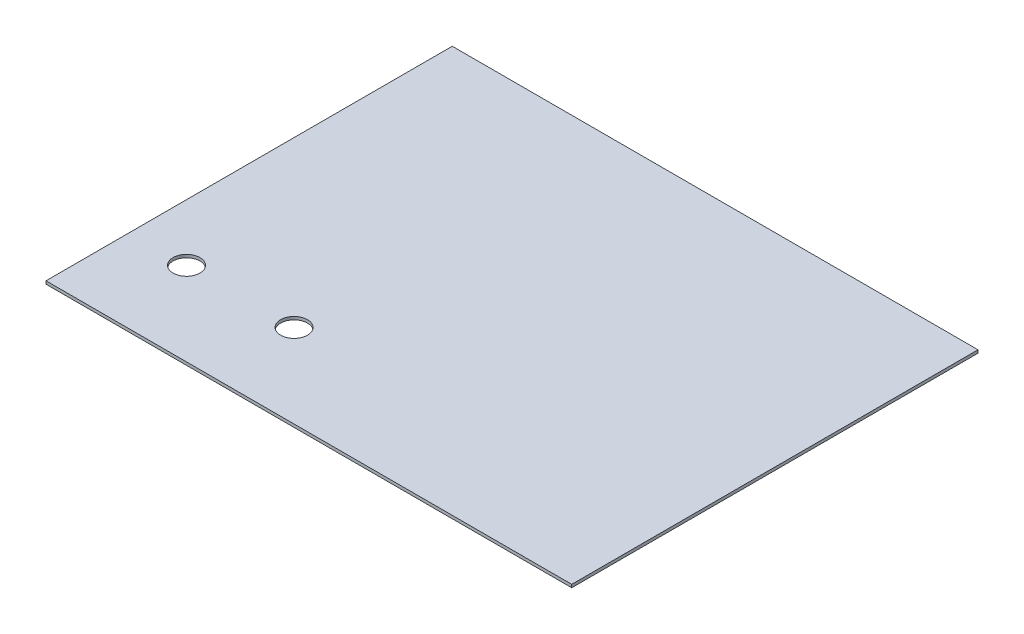
from build123d import *

# Parameters (mm, degrees)
SKETCH1_W           = 558.8
SKETCH1_H           = 431.8
BOSS_EXTRUDE1_DEPTH = 3.175
SKETCH2_R           = 14.2875
CUT_EXTRUDE1_DEPTH  = 3.175


with BuildPart() as part:
    # Sketch1 → Boss-Extrude1 (new body)
    with BuildSketch(Plane(origin=(0, 0, 0), x_dir=(1, 0, 0), z_dir=(0, 1, 0))):
        with Locations((279.4, 215.9)):
            Rectangle(SKETCH1_W, SKETCH1_H)
    extrude(amount=BOSS_EXTRUDE1_DEPTH)

    # Sketch2 → Cut-Extrude1 (cut)
    with BuildSketch(Plane(origin=(0, 3.175, 0), x_dir=(1, 0, 0), z_dir=(0, 1, 0))):
        with Locations((60.460569695, 88.9)):
            Circle(SKETCH2_R)
        with Locations((174.760569695, 88.9)):
            Circle(SKETCH2_R)
    extrude(amount=-CUT_EXTRUDE1_DEPTH, mode=Mode.SUBTRACT)


solid = part.part
